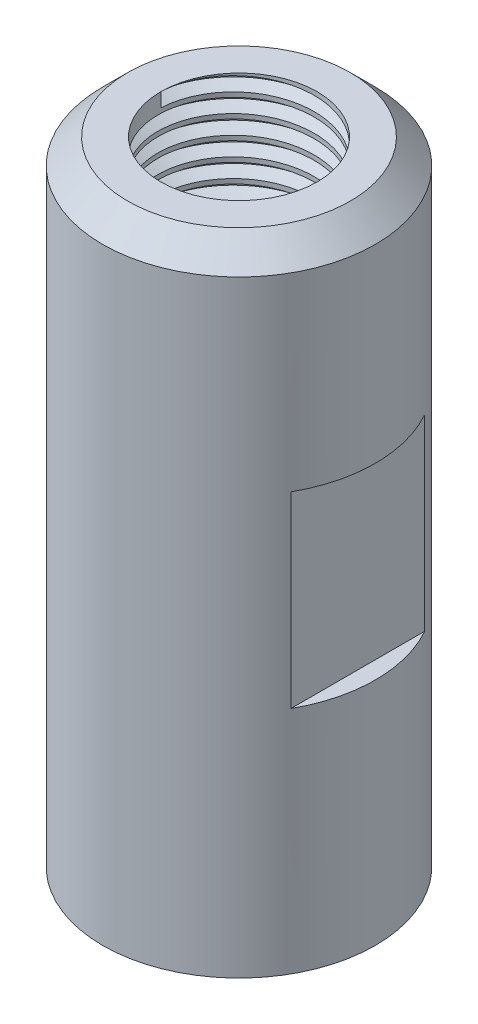
from build123d import *

# Parameters (mm, degrees)
SKETCH1_R               = 10.9
BOSS_EXTRUDE1_DEPTH     = 50.54
SKETCH2_R               = 6.25
CUT_EXTRUDE1_DEPTH      = 20
THREAD1_PITCH           = 1.5
CUT_EXTRUDE2_DEPTH      = 16
CUT_EXTRUDE2_DEPTH_BACK = 16
SKETCH23_W              = 18.439973048
SKETCH23_H              = 15
CUT_EXTRUDE3_OUTLINE_R  = 7.5
CUT_EXTRUDE3_DEPTH      = 30.54
CHAMFER1_SIZE           = 2


# Read off the part's stored shape, not the designer's step: Cut-Extrude3
with BuildPart() as part:
    # Sketch1 → Boss-Extrude1 (new body)
    with BuildSketch(Plane(origin=(0, 84, 0), x_dir=(1, 0, 0), z_dir=(0, 1, 0))):
        with Locations(Location((0, 0, 0), (0, 0, 180))):
            Circle(SKETCH1_R)
    extrude(amount=-BOSS_EXTRUDE1_DEPTH)

    # Sketch2 → Cut-Extrude1 (cut)
    with BuildSketch(Plane(origin=(0, 84, 0), x_dir=(-1, 0, 0), z_dir=(0, -1, 0))):
        with Locations(Location((0, 0, 0), (0, 0, 180))):
            Circle(SKETCH2_R)
    extrude(amount=CUT_EXTRUDE1_DEPTH, mode=Mode.SUBTRACT)

    # Thread1: the profile of Thread Profile1 profile screwed along a right-hand helix of 17.333333 turns, 8 arcs to a turn; built about Z, then put on its axis
    thread1_z = Axis((0, 0, 0), (0, 0, 1))
    thread1_corners = [(6.2497, 0, -0.000173205), (7.061898813, 0, 0.468749998), (7.061898813, 0, 0.656249998), (6.2497, 0, 1.125173201)]
    with BuildLine(mode=Mode.PRIVATE) as thread1_profile:
        Line(thread1_corners[0], thread1_corners[1])
        Line(thread1_corners[1], thread1_corners[2])
        Line(thread1_corners[2], thread1_corners[3])
        Line(thread1_corners[3], thread1_corners[0])
    thread1_cap = Face(thread1_profile.wire())
    thread1_turn_angles = [0, 22.5, 45, 67.5, 90, 112.5, 135, 157.5, 180, 202.5, 225, 247.5, 270, 292.5, 315, 337.5, 360]
    thread1_turn_weights = [1, 0.9238795325112867, 1, 0.9238795325112867, 1, 0.9238795325112867, 1, 0.9238795325112867, 1, 0.9238795325112867, 1, 0.9238795325112867, 1, 0.9238795325112867, 1, 0.9238795325112867, 1]
    thread1_turn_rails = [Edge.make_bspline([Vector(p[0], p[1], 0).rotate(thread1_z, thread1_turn_angles[k]) / thread1_turn_weights[k] + Vector(0, 0, p[2] + THREAD1_PITCH * thread1_turn_angles[k] / 360) for k in range(17)], [0, 0, 0, 1, 1, 2, 2, 3, 3, 4, 4, 5, 5, 6, 6, 7, 7, 8, 8, 8], 2, thread1_turn_weights) for p in thread1_corners]
    thread1_turn_sides = [Face.make_surface_from_curves(thread1_turn_rails[p[0]], thread1_turn_rails[p[1]]) for p in [(0, 1), (1, 2), (2, 3), (3, 0)]]
    thread1_last_angles = [6120, 6142.5, 6165, 6187.5, 6210, 6225, 6240]
    thread1_last_weights = [1, 0.9238795325112867, 1, 0.9238795325112867, 1, 0.9659258262890683, 1]
    thread1_last_rails = [Edge.make_bspline([Vector(p[0], p[1], 0).rotate(thread1_z, thread1_last_angles[k]) / thread1_last_weights[k] + Vector(0, 0, p[2] + THREAD1_PITCH * thread1_last_angles[k] / 360) for k in range(7)], [0, 0, 0, 1, 1, 2, 2, 3, 3, 3], 2, thread1_last_weights) for p in thread1_corners]
    thread1_last_sides = [Face.make_surface_from_curves(thread1_last_rails[p[0]], thread1_last_rails[p[1]]) for p in [(0, 1), (1, 2), (2, 3), (3, 0)]]
    thread1 = Plane(origin=(0, 84, 0), x_dir=(-1, 0, 0), z_dir=(0, -1, 0)) * Solid(Shell([*[p.moved(Location((0, 0, THREAD1_PITCH * i))) for i in range(17) for p in thread1_turn_sides], *thread1_last_sides, thread1_cap, thread1_cap.rotate(thread1_z, 6240).moved(Location((0, 0, THREAD1_PITCH * 6240 / 360)))]))
    add(thread1, mode=Mode.SUBTRACT)

    # Sketch23 → Cut-Extrude2 (cut, two sides: drawn at the far end of the back side and taken through both)
    with BuildSketch(Plane.XY.offset(-CUT_EXTRUDE2_DEPTH_BACK)):
        with Locations((18.719986524, 59.343499547)):
            Rectangle(SKETCH23_W, SKETCH23_H)
        with Locations((-18.719986524, 59.343499547)):
            Rectangle(SKETCH23_W, SKETCH23_H)
    extrude(amount=CUT_EXTRUDE2_DEPTH + CUT_EXTRUDE2_DEPTH_BACK, mode=Mode.SUBTRACT)

    # Cut-Extrude3 outline → Cut-Extrude3 (cut)
    with BuildSketch(Plane(origin=(0, 33.46, 0), x_dir=(-1, 0, 0), z_dir=(0, 1, 0))):
        Circle(CUT_EXTRUDE3_OUTLINE_R)
    extrude(amount=CUT_EXTRUDE3_DEPTH, mode=Mode.SUBTRACT)

    # Chamfer1
    chamfer1_edges = [part.edges().sort_by_distance(p)[0] for p in [
        (10.9, 84, 0),
    ]]
    chamfer(chamfer1_edges, length=CHAMFER1_SIZE)


solid = part.part
